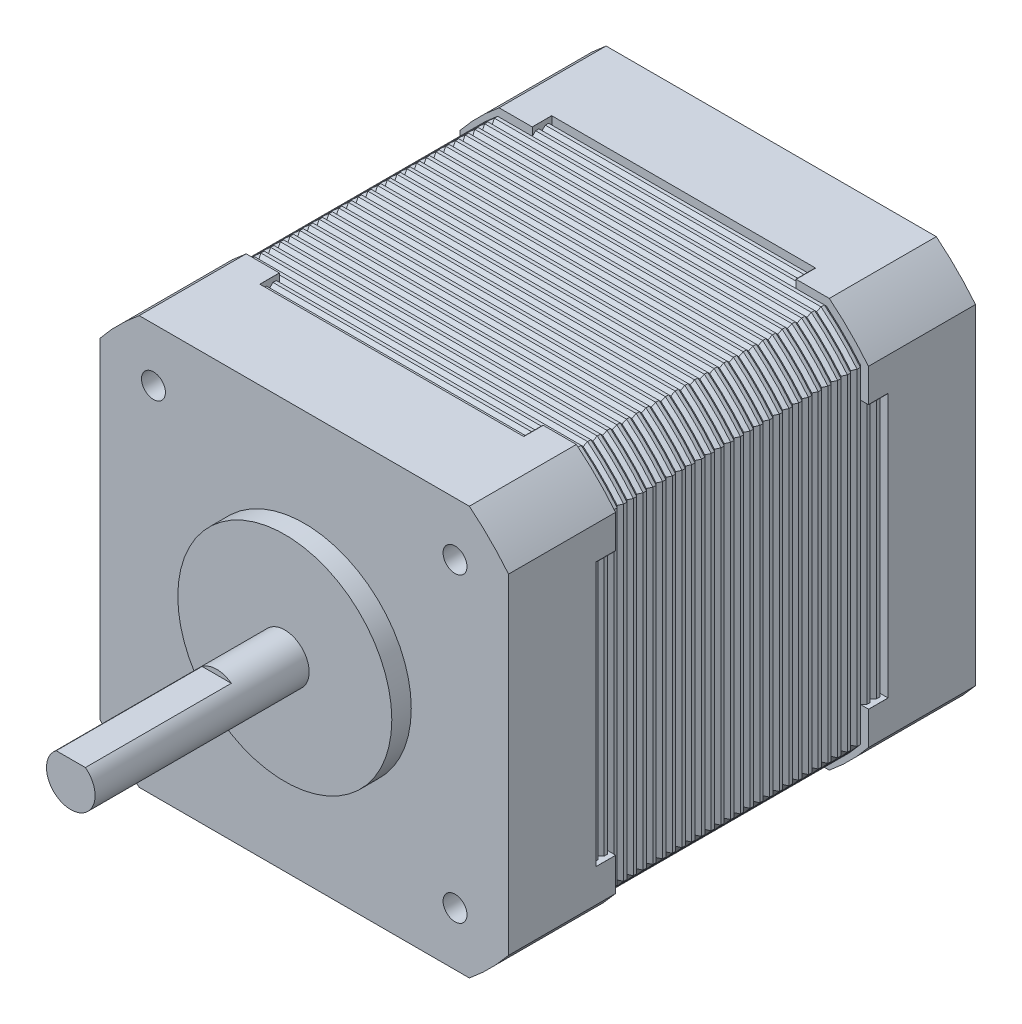
from build123d import *

# Parameters (mm, degrees)
CUT_EXTRUDE2_START       = -42.02
CUT_EXTRUDE2_OUTLINE_W   = 27.098332052
CUT_EXTRUDE2_OUTLINE_H   = 21.116
CUT_EXTRUDE2_DEPTH       = 42.02
CUT_EXTRUDE2_START_2     = 39.116
CUT_EXTRUDE2_2_OUTLINE_R = 11
CUT_EXTRUDE2_2_DEPTH     = 2
CUT_EXTRUDE2_START_3     = 41.116
CUT_EXTRUDE2_3_DEPTH     = 22
CUT_EXTRUDE2_4_DEPTH     = 7
CUT_EXTRUDE2_START_4     = 11
CUT_EXTRUDE2_5_DEPTH     = 17.116
CUT_EXTRUDE2_START_5     = -1
CUT_EXTRUDE2_6_DEPTH     = 40.116
CUT_EXTRUDE2_7_DEPTH     = 10
CUT_EXTRUDE2_START_6     = 30.116
CUT_EXTRUDE2_8_DEPTH     = 9
SKETCH3_W                = 21.116
SKETCH3_H                = 27.098332052
CUT_EXTRUDE3_DEPTH       = 79.681191882
SKETCH4_W                = 239.285222251
SKETCH4_H                = 256.624820268
CUT_EXTRUDE4_DEPTH       = 28.116
BOSS_EXTRUDE1_DEPTH      = 1
CHAMFER1_SIZE            = 0.33
LPATTERN1_COUNT          = 30
LPATTERN1_PITCH          = 1
CUT_EXTRUDE5_DEPTH       = 78.88992361


with BuildPart() as part:
    # Cut-Extrude2: read off the stored shape, not the designer's step
    # Cut-Extrude2 outline → Cut-Extrude2 (new body)
    with BuildSketch(Plane(origin=(0, 21.01, 0), x_dir=(1, 0, 0), z_dir=(0, 1, 0)).offset(CUT_EXTRUDE2_START)):
        Polygon((21, -39.116), (21, -30.116), (21.01, -30.116), (21.01, -9), (21, -9), (21, 0), (-21, 0), (-21, -9), (-21.01, -9), (-21.01, -30.116), (-21, -30.116), (-21, -39.116), align=None)
        with Locations((0, -19.558)):
            Rectangle(CUT_EXTRUDE2_OUTLINE_W, CUT_EXTRUDE2_OUTLINE_H, mode=Mode.SUBTRACT)
    extrude(amount=CUT_EXTRUDE2_DEPTH)

    # Cut-Extrude2 2 outline → Cut-Extrude2 2 (add)
    with BuildSketch(Plane.XY.offset(CUT_EXTRUDE2_START_2)):
        Circle(CUT_EXTRUDE2_2_OUTLINE_R)
    extrude(amount=CUT_EXTRUDE2_2_DEPTH)

    # Cut-Extrude2 3 outline → Cut-Extrude2 3 (add)
    with BuildSketch(Plane.XY.offset(CUT_EXTRUDE2_START_3)):
        with BuildLine():
            Line((1.5, 2), (-1.5, 2))
            ThreePointArc((-1.5, 2), (0, -2.5), (1.5, 2))
        make_face()
    extrude(amount=CUT_EXTRUDE2_3_DEPTH)

    # Cut-Extrude2 4 outline → Cut-Extrude2 4 (add)
    with BuildSketch(Plane.XY.offset(CUT_EXTRUDE2_START_3)):
        with BuildLine():
            ThreePointArc((1.5, 2), (0, 2.5), (-1.5, 2))
            Line((-1.5, 2), (1.5, 2))
        make_face()
    extrude(amount=CUT_EXTRUDE2_4_DEPTH)

    # Cut-Extrude2 5 outline → Cut-Extrude2 5 (cut)
    with BuildSketch(Plane.XY.offset(CUT_EXTRUDE2_START_4)):
        with BuildLine():
            Line((21.01, 13.549166026), (21.01, 21.01))
            Line((21.01, 21.01), (13.549166026, 21.01))
            ThreePointArc((13.549166026, 21.01), (17.67766953, 17.67766953), (21.01, 13.549166026))
        make_face()
        with BuildLine():
            Line((13.549166026, -21.01), (21.01, -21.01))
            Line((21.01, -21.01), (21.01, -13.549166026))
            ThreePointArc((21.01, -13.549166026), (17.67766953, -17.67766953), (13.549166026, -21.01))
        make_face()
        with BuildLine():
            Line((-13.549166026, 21.01), (-21.01, 21.01))
            Line((-21.01, 21.01), (-21.01, 13.549166026))
            ThreePointArc((-21.01, 13.549166026), (-17.67766953, 17.67766953), (-13.549166026, 21.01))
        make_face()
        with BuildLine():
            ThreePointArc((-13.549166026, -21.01), (-17.67766953, -17.67766953), (-21.01, -13.549166026))
            Line((-21.01, -13.549166026), (-21.01, -21.01))
            Line((-21.01, -21.01), (-13.549166026, -21.01))
        make_face()
    extrude(amount=CUT_EXTRUDE2_5_DEPTH, mode=Mode.SUBTRACT)

    # Cut-Extrude2 6 outline → Cut-Extrude2 6 (cut)
    with BuildSketch(Plane.XY.offset(CUT_EXTRUDE2_START_5)):
        with BuildLine():
            ThreePointArc((16.970562748, 21), (19.091883092, 19.091883092), (21, 16.970562748))
            Line((21, 16.970562748), (21, 13.564659966))
            ThreePointArc((21, 13.564659966), (21.005001429, 13.556913918), (21.01, 13.549166026))
            Line((21.01, 13.549166026), (21.01, 21.01))
            Line((21.01, 21.01), (13.549166026, 21.01))
            ThreePointArc((13.549166026, 21.01), (13.556913918, 21.005001429), (13.564659966, 21))
            Line((13.564659966, 21), (16.970562748, 21))
        make_face()
        with BuildLine():
            ThreePointArc((21.01, -13.549166026), (21.005001429, -13.556913918), (21, -13.564659966))
            Line((21, -13.564659966), (21, -16.970562748))
            ThreePointArc((21, -16.970562748), (19.091883092, -19.091883092), (16.970562748, -21))
            Line((16.970562748, -21), (13.564659966, -21))
            ThreePointArc((13.564659966, -21), (13.556913918, -21.005001429), (13.549166026, -21.01))
            Line((13.549166026, -21.01), (21.01, -21.01))
            Line((21.01, -21.01), (21.01, -13.549166026))
        make_face()
        with BuildLine():
            Line((-16.970562748, 21), (-13.564659966, 21))
            ThreePointArc((-13.564659966, 21), (-13.556913918, 21.005001429), (-13.549166026, 21.01))
            Line((-13.549166026, 21.01), (-21.01, 21.01))
            Line((-21.01, 21.01), (-21.01, 13.549166026))
            ThreePointArc((-21.01, 13.549166026), (-21.005001429, 13.556913918), (-21, 13.564659966))
            Line((-21, 13.564659966), (-21, 16.970562748))
            ThreePointArc((-21, 16.970562748), (-19.091883092, 19.091883092), (-16.970562748, 21))
        make_face()
        with BuildLine():
            ThreePointArc((-13.549166026, -21.01), (-13.556913918, -21.005001429), (-13.564659966, -21))
            Line((-13.564659966, -21), (-16.970562748, -21))
            ThreePointArc((-16.970562748, -21), (-19.091883092, -19.091883092), (-21, -16.970562748))
            Line((-21, -16.970562748), (-21, -13.564659966))
            ThreePointArc((-21, -13.564659966), (-21.005001429, -13.556913918), (-21.01, -13.549166026))
            Line((-21.01, -13.549166026), (-21.01, -21.01))
            Line((-21.01, -21.01), (-13.549166026, -21.01))
        make_face()
    extrude(amount=CUT_EXTRUDE2_6_DEPTH, mode=Mode.SUBTRACT)

    # Cut-Extrude2 7 outline → Cut-Extrude2 7 (cut)
    with BuildSketch(Plane.XY.offset(CUT_EXTRUDE2_START_5)):
        with BuildLine():
            Line((-13.564659966, 21), (13.564659966, 21))
            ThreePointArc((13.564659966, 21), (13.556913918, 21.005001429), (13.549166026, 21.01))
            Line((13.549166026, 21.01), (-13.549166026, 21.01))
            ThreePointArc((-13.549166026, 21.01), (-13.556913918, 21.005001429), (-13.564659966, 21))
        make_face()
        with BuildLine():
            ThreePointArc((13.549166026, -21.01), (13.556913918, -21.005001429), (13.564659966, -21))
            Line((13.564659966, -21), (-13.564659966, -21))
            ThreePointArc((-13.564659966, -21), (-13.556913918, -21.005001429), (-13.549166026, -21.01))
            Line((-13.549166026, -21.01), (13.549166026, -21.01))
        make_face()
    extrude(amount=CUT_EXTRUDE2_7_DEPTH, mode=Mode.SUBTRACT)

    # Cut-Extrude2 8 outline → Cut-Extrude2 8 (cut)
    with BuildSketch(Plane.XY.offset(CUT_EXTRUDE2_START_6)):
        with BuildLine():
            Line((-13.564659966, 21), (13.564659966, 21))
            ThreePointArc((13.564659966, 21), (13.556913918, 21.005001429), (13.549166026, 21.01))
            Line((13.549166026, 21.01), (-13.549166026, 21.01))
            ThreePointArc((-13.549166026, 21.01), (-13.556913918, 21.005001429), (-13.564659966, 21))
        make_face()
        with BuildLine():
            ThreePointArc((13.549166026, -21.01), (13.556913918, -21.005001429), (13.564659966, -21))
            Line((13.564659966, -21), (-13.564659966, -21))
            ThreePointArc((-13.564659966, -21), (-13.556913918, -21.005001429), (-13.549166026, -21.01))
            Line((-13.549166026, -21.01), (13.549166026, -21.01))
        make_face()
    extrude(amount=CUT_EXTRUDE2_8_DEPTH, mode=Mode.SUBTRACT)

    # Cut-Extrude2 9 outline → Cut-Extrude2 9 (revolve, cut)
    with BuildSketch(Plane(origin=(-15.5, -15.5, 0), x_dir=(1, 0, 0), z_dir=(0, -1, 0))):
        Polygon((0, 39.116), (0, 28.377241869), (1.2295, 29.116), (1.2295, 39.116), align=None)
    revolve(axis=Axis((-15.5, -15.5, 0), (0, 0, 1)), mode=Mode.SUBTRACT)

    # Cut-Extrude2 10 outline → Cut-Extrude2 10 (revolve, cut)
    with BuildSketch(Plane(origin=(15.5, 15.5, 0), x_dir=(1, 0, 0), z_dir=(0, -1, 0))):
        Polygon((0, 39.116), (0, 28.377241869), (1.2295, 29.116), (1.2295, 39.116), align=None)
    revolve(axis=Axis((15.5, 15.5, 0), (0, 0, 1)), mode=Mode.SUBTRACT)

    # Cut-Extrude2 11 outline → Cut-Extrude2 11 (revolve, cut)
    with BuildSketch(Plane(origin=(15.5, -15.5, 0), x_dir=(1, 0, 0), z_dir=(0, -1, 0))):
        Polygon((0, 39.116), (0, 28.377241869), (1.2295, 29.116), (1.2295, 39.116), align=None)
    revolve(axis=Axis((15.5, -15.5, 0), (0, 0, 1)), mode=Mode.SUBTRACT)

    # Cut-Extrude2 12 outline → Cut-Extrude2 12 (revolve, cut)
    with BuildSketch(Plane(origin=(-15.5, 15.5, 0), x_dir=(1, 0, 0), z_dir=(0, -1, 0))):
        Polygon((0, 39.116), (0, 28.377241869), (1.2295, 29.116), (1.2295, 39.116), align=None)
    revolve(axis=Axis((-15.5, 15.5, 0), (0, 0, 1)), mode=Mode.SUBTRACT)

    # Sketch3 → Cut-Extrude3 (cut, through all)
    with BuildSketch(Plane(origin=(21.01, 0, 0), x_dir=(0, 0, -1), z_dir=(1, 0, 0))):
        with Locations((-19.558, 0)):
            Rectangle(SKETCH3_W, SKETCH3_H)
    extrude(amount=-CUT_EXTRUDE3_DEPTH, mode=Mode.SUBTRACT)

    # Sketch4 → Cut-Extrude4 (cut)
    with BuildSketch(Plane(origin=(0, 0, 0), x_dir=(-1, 0, 0), z_dir=(0, 0, -1))):
        with Locations((60.588245034, 67.261770714)):
            Rectangle(SKETCH4_W, SKETCH4_H)
    extrude(amount=-CUT_EXTRUDE4_DEPTH, mode=Mode.SUBTRACT)


with BuildPart() as body_2:
    # Sketch5 → Boss-Extrude1 (new body)
    with BuildSketch(Plane(origin=(0, 0, 30.116), x_dir=(-1, 0, 0), z_dir=(0, 0, -1))):
        with BuildLine():
            Line((16.792855624, 20.5), (-16.792855624, 20.5))
            ThreePointArc((-16.792855624, 20.5), (-18.738329701, 18.738329701), (-20.5, 16.792855624))
            Line((-20.5, 16.792855624), (-20.5, -16.792855624))
            ThreePointArc((-20.5, -16.792855624), (-18.738329701, -18.738329701), (-16.792855624, -20.5))
            Line((-16.792855624, -20.5), (16.792855624, -20.5))
            ThreePointArc((16.792855624, -20.5), (18.738329701, -18.738329701), (20.5, -16.792855624))
            Line((20.5, -16.792855624), (20.5, 16.792855624))
            ThreePointArc((20.5, 16.792855624), (18.738329701, 18.738329701), (16.792855624, 20.5))
        make_face()
    extrude(amount=BOSS_EXTRUDE1_DEPTH)

    # Chamfer1
    chamfer1_edges = [body_2.edges().sort_by_distance(p)[0] for p in [
        (18.738329701, 18.738329701, 29.116),
        (0, 20.5, 30.116),
        (-18.738329701, 18.738329701, 30.116),
        (20.5, 0, 29.116),
        (18.738329701, -18.738329701, 29.116),
        (0, -20.5, 29.116),
        (-18.738329701, -18.738329701, 29.116),
        (-20.5, 0, 29.116),
        (-18.738329701, 18.738329701, 29.116),
        (0, 20.5, 29.116),
        (-20.5, 0, 30.116),
        (-18.738329701, -18.738329701, 30.116),
        (0, -20.5, 30.116),
        (18.738329701, -18.738329701, 30.116),
        (20.5, 0, 30.116),
        (18.738329701, 18.738329701, 30.116),
    ]]
    chamfer(chamfer1_edges, length=CHAMFER1_SIZE)


with BuildPart() as lpattern1_1:
    # LPattern1: pattern copy
    add(body_2.part.moved(Location(Vector(0, 0, -1) * (1 * LPATTERN1_PITCH))))


with BuildPart() as lpattern1_2:
    # LPattern1: pattern copy
    add(body_2.part.moved(Location(Vector(0, 0, -1) * (2 * LPATTERN1_PITCH))))


with BuildPart() as lpattern1_3:
    # LPattern1: pattern copy
    add(body_2.part.moved(Location(Vector(0, 0, -1) * (3 * LPATTERN1_PITCH))))


with BuildPart() as lpattern1_4:
    # LPattern1: pattern copy
    add(body_2.part.moved(Location(Vector(0, 0, -1) * (4 * LPATTERN1_PITCH))))


with BuildPart() as lpattern1_5:
    # LPattern1: pattern copy
    add(body_2.part.moved(Location(Vector(0, 0, -1) * (5 * LPATTERN1_PITCH))))


with BuildPart() as lpattern1_6:
    # LPattern1: pattern copy
    add(body_2.part.moved(Location(Vector(0, 0, -1) * (6 * LPATTERN1_PITCH))))


with BuildPart() as lpattern1_7:
    # LPattern1: pattern copy
    add(body_2.part.moved(Location(Vector(0, 0, -1) * (7 * LPATTERN1_PITCH))))


with BuildPart() as lpattern1_8:
    # LPattern1: pattern copy
    add(body_2.part.moved(Location(Vector(0, 0, -1) * (8 * LPATTERN1_PITCH))))


with BuildPart() as lpattern1_9:
    # LPattern1: pattern copy
    add(body_2.part.moved(Location(Vector(0, 0, -1) * (9 * LPATTERN1_PITCH))))


with BuildPart() as lpattern1_10:
    # LPattern1: pattern copy
    add(body_2.part.moved(Location(Vector(0, 0, -1) * (10 * LPATTERN1_PITCH))))


with BuildPart() as lpattern1_11:
    # LPattern1: pattern copy
    add(body_2.part.moved(Location(Vector(0, 0, -1) * (11 * LPATTERN1_PITCH))))


with BuildPart() as lpattern1_12:
    # LPattern1: pattern copy
    add(body_2.part.moved(Location(Vector(0, 0, -1) * (12 * LPATTERN1_PITCH))))


with BuildPart() as lpattern1_13:
    # LPattern1: pattern copy
    add(body_2.part.moved(Location(Vector(0, 0, -1) * (13 * LPATTERN1_PITCH))))


with BuildPart() as lpattern1_14:
    # LPattern1: pattern copy
    add(body_2.part.moved(Location(Vector(0, 0, -1) * (14 * LPATTERN1_PITCH))))


with BuildPart() as lpattern1_15:
    # LPattern1: pattern copy
    add(body_2.part.moved(Location(Vector(0, 0, -1) * (15 * LPATTERN1_PITCH))))


with BuildPart() as lpattern1_16:
    # LPattern1: pattern copy
    add(body_2.part.moved(Location(Vector(0, 0, -1) * (16 * LPATTERN1_PITCH))))


with BuildPart() as lpattern1_17:
    # LPattern1: pattern copy
    add(body_2.part.moved(Location(Vector(0, 0, -1) * (17 * LPATTERN1_PITCH))))


with BuildPart() as lpattern1_18:
    # LPattern1: pattern copy
    add(body_2.part.moved(Location(Vector(0, 0, -1) * (18 * LPATTERN1_PITCH))))


with BuildPart() as lpattern1_19:
    # LPattern1: pattern copy
    add(body_2.part.moved(Location(Vector(0, 0, -1) * (19 * LPATTERN1_PITCH))))


with BuildPart() as lpattern1_20:
    # LPattern1: pattern copy
    add(body_2.part.moved(Location(Vector(0, 0, -1) * (20 * LPATTERN1_PITCH))))


with BuildPart() as lpattern1_21:
    # LPattern1: pattern copy
    add(body_2.part.moved(Location(Vector(0, 0, -1) * (21 * LPATTERN1_PITCH))))


with BuildPart() as lpattern1_22:
    # LPattern1: pattern copy
    add(body_2.part.moved(Location(Vector(0, 0, -1) * (22 * LPATTERN1_PITCH))))


with BuildPart() as lpattern1_23:
    # LPattern1: pattern copy
    add(body_2.part.moved(Location(Vector(0, 0, -1) * (23 * LPATTERN1_PITCH))))


with BuildPart() as lpattern1_24:
    # LPattern1: pattern copy
    add(body_2.part.moved(Location(Vector(0, 0, -1) * (24 * LPATTERN1_PITCH))))


with BuildPart() as lpattern1_25:
    # LPattern1: pattern copy
    add(body_2.part.moved(Location(Vector(0, 0, -1) * (25 * LPATTERN1_PITCH))))


with BuildPart() as lpattern1_26:
    # LPattern1: pattern copy
    add(body_2.part.moved(Location(Vector(0, 0, -1) * (26 * LPATTERN1_PITCH))))


with BuildPart() as lpattern1_27:
    # LPattern1: pattern copy
    add(body_2.part.moved(Location(Vector(0, 0, -1) * (27 * LPATTERN1_PITCH))))


with BuildPart() as lpattern1_28:
    # LPattern1: pattern copy
    add(body_2.part.moved(Location(Vector(0, 0, -1) * (28 * LPATTERN1_PITCH))))


with BuildPart() as lpattern1_29:
    # LPattern1: pattern copy
    add(body_2.part.moved(Location(Vector(0, 0, -1) * (29 * LPATTERN1_PITCH))))


with BuildPart() as body_32:
    # Mirror1: mirrored copy
    add(part.part.mirror(Plane.XY.offset(15.116)))

    # Sketch6 → Cut-Extrude5 (cut, through all)
    with BuildSketch(Plane(origin=(0, 0, -8.884), x_dir=(-1, 0, 0), z_dir=(0, 0, -1))):
        with BuildLine():
            Line((16.970562748, 21), (-16.970562748, 21))
            ThreePointArc((-16.970562748, 21), (-19.091883092, 19.091883092), (-21, 16.970562748))
            Line((-21, 16.970562748), (-21, -16.970562748))
            ThreePointArc((-21, -16.970562748), (-19.091883092, -19.091883092), (-16.970562748, -21))
            Line((-16.970562748, -21), (16.970562748, -21))
            ThreePointArc((16.970562748, -21), (19.091883092, -19.091883092), (21, -16.970562748))
            Line((21, -16.970562748), (21, 16.970562748))
            ThreePointArc((21, 16.970562748), (19.091883092, 19.091883092), (16.970562748, 21))
        make_face()
    extrude(amount=CUT_EXTRUDE5_DEPTH, mode=Mode.SUBTRACT)


solid = Compound([part.part, body_2.part, lpattern1_1.part, lpattern1_2.part, lpattern1_3.part, lpattern1_4.part, lpattern1_5.part, lpattern1_6.part, lpattern1_7.part, lpattern1_8.part, lpattern1_9.part, lpattern1_10.part, lpattern1_11.part, lpattern1_12.part, lpattern1_13.part, lpattern1_14.part, lpattern1_15.part, lpattern1_16.part, lpattern1_17.part, lpattern1_18.part, lpattern1_19.part, lpattern1_20.part, lpattern1_21.part, lpattern1_22.part, lpattern1_23.part, lpattern1_24.part, lpattern1_25.part, lpattern1_26.part, lpattern1_27.part, lpattern1_28.part, lpattern1_29.part, body_32.part])
